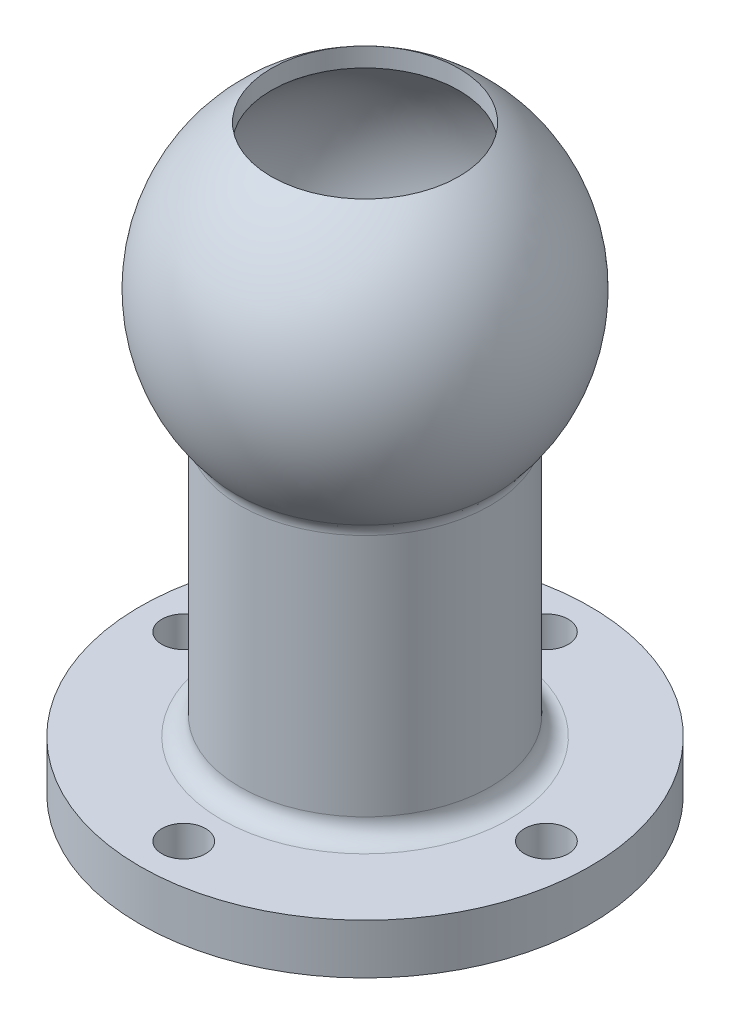
from build123d import *

# Parameters (mm, degrees)
IZIM1_R                     = 36
Y_KSEKLIK_EKSTR_ZYON1_DEPTH = 8
IZIM2_R                     = 3.5
KES_EKSTR_ZYON1_DEPTH       = 8
IZIM3_R                     = 17.5
KES_EKSTR_ZYON2_DEPTH       = 2
IZIM4_W                     = 20
IZIM4_H                     = 29
KES_EKSTR_ZYON3_DEPTH       = 29
KES_EKSTR_ZYON3_DEPTH_BACK  = 6
IZIM5_R                     = 15
Y_KSEKLIK_EKSTR_ZYON2_START = 3
IZIM6_R                     = 20
Y_KSEKLIK_EKSTR_ZYON2_DEPTH = 3
IZIM8_R                     = 12.5
KES_EKSTR_ZYON4_DEPTH       = 3
IZIM13_R                    = 15
KES_EKSTR_ZYON5_DEPTH       = 65
RADYUS2_R                   = 3
RADYUS3_R                   = 3
RADYUS4_R                   = 3


with BuildPart() as part:
    # Çizim1 → Yükseklik-Ekstrüzyon1 (new body)
    with BuildSketch(Plane(origin=(0, 0, 0), x_dir=(1, 0, 0), z_dir=(0, 1, 0))):
        with Locations(Location((0, 0, 0), (0, 0, 270))):
            Circle(IZIM1_R)
    extrude(amount=Y_KSEKLIK_EKSTR_ZYON1_DEPTH)

    # Çizim2 → Kes-Ekstrüzyon1 (cut)
    with BuildSketch(Plane(origin=(0, 8, 0), x_dir=(1, 0, 0), z_dir=(0, 1, 0))):
        with Locations(Location((0, 29, 0), (0, 0, 270))):
            Circle(IZIM2_R)
        with Locations(Location((29, 0, 0), (0, 0, 270))):
            Circle(IZIM2_R)
        with Locations(Location((0, -29, 0), (0, 0, 270))):
            Circle(IZIM2_R)
        with Locations(Location((-29, 0, 0), (0, 0, 270))):
            Circle(IZIM2_R)
    extrude(amount=-KES_EKSTR_ZYON1_DEPTH, mode=Mode.SUBTRACT)

    # Çizim3 → Kes-Ekstrüzyon2 (cut)
    with BuildSketch(Plane.XZ):
        with Locations(Location((0, 0, 0), (0, 0, 270))):
            Circle(IZIM3_R)
    extrude(amount=-KES_EKSTR_ZYON2_DEPTH, mode=Mode.SUBTRACT)

    # Çizim4 → Döndür1 (revolve)
    with BuildSketch(Plane(origin=(0, 0, 0), x_dir=(0, 0, -1), z_dir=(1, 0, 0)), mode=Mode.PRIVATE) as d_nd_r1_sk:
        with Locations((10, 22.5)):
            Rectangle(IZIM4_W, IZIM4_H)
    revolve(d_nd_r1_sk.sketch.rotate(Axis((0, 37, 0), (0, -1, 0)), 180), axis=Axis((0, 37, 0), (0, -1, 0)))

    # Çizim5 → Kes-Ekstrüzyon3 (cut, two sides: drawn at the far end of the back side and taken through both)
    with BuildSketch(Plane(origin=(0, 8, 0), x_dir=(1, 0, 0), z_dir=(0, 1, 0)).offset(-KES_EKSTR_ZYON3_DEPTH_BACK)):
        with Locations(Location((0, 0, 0), (0, 0, 270))):
            Circle(IZIM5_R)
    extrude(amount=KES_EKSTR_ZYON3_DEPTH + KES_EKSTR_ZYON3_DEPTH_BACK, mode=Mode.SUBTRACT)

    # Çizim6 → Yükseklik-Ekstrüzyon2 (add)
    with BuildSketch(Plane(origin=(0, 37, 0), x_dir=(1, 0, 0), z_dir=(0, 1, 0)).offset(Y_KSEKLIK_EKSTR_ZYON2_START)):
        with Locations(Location((0, 0, 0), (0, 0, 270))):
            Circle(IZIM6_R)
    extrude(amount=-Y_KSEKLIK_EKSTR_ZYON2_DEPTH)

    # Çizim8 → Kes-Ekstrüzyon4 (cut)
    with BuildSketch(Plane.XZ.offset(-37)):
        with Locations(Location((0, 0, 0), (0, 0, 270))):
            Circle(IZIM8_R)
    extrude(amount=-KES_EKSTR_ZYON4_DEPTH, mode=Mode.SUBTRACT)



with BuildPart() as body_2:
    # Çizim10 → Döndür15 (revolve)
    with BuildSketch(Plane.XY, mode=Mode.PRIVATE) as d_nd_r15_sk:
        with BuildLine():
            Line((0, 95), (0, 97.5))
            ThreePointArc((0, 97.5), (-25.251743677, 80.89033706), (-20, 51.125413912))
            ThreePointArc((-20, 51.125413912), (-10.89033706, 44.748256323), (0, 42.5))
            Line((0, 42.5), (0, 45))
            ThreePointArc((0, 45), (-25, 70), (0, 95))
        make_face()
    revolve(d_nd_r15_sk.sketch.rotate(Axis((0, 97.5, 0), (0, -1, 0)), 180), axis=Axis((0, 97.5, 0), (0, -1, 0)))


with BuildPart() as part_1:
    add(part.part)

    add(body_2.part)  # Döndür17 merges body 2
    # Çizim10<16> → Döndür17 (revolve)
    with BuildSketch(Plane.XY, mode=Mode.PRIVATE) as d_nd_r17_sk:
        with BuildLine():
            Line((-20, 51.125413912), (-20, 40))
            Line((-20, 40), (0, 40))
            Line((0, 40), (0, 42.5))
            ThreePointArc((0, 42.5), (-10.89033706, 44.748256323), (-20, 51.125413912))
        make_face()
    revolve(d_nd_r17_sk.sketch.rotate(Axis((0, 97.5, 0), (0, -1, 0)), 270), axis=Axis((0, 97.5, 0), (0, -1, 0)))

    # Çizim13 → Kes-Ekstrüzyon5 (cut)
    with BuildSketch(Plane.XZ.offset(-40)):
        with Locations(Location((0, 0, 0), (0, 0, 90))):
            Circle(IZIM13_R)
    extrude(amount=-KES_EKSTR_ZYON5_DEPTH, mode=Mode.SUBTRACT)

    # Radyus2
    radyus2_edges = [part_1.edges().sort_by_distance(p)[0] for p in [
        (14.142135624, 51.125413912, 14.142135624),
    ]]
    fillet(radyus2_edges, radius=RADYUS2_R)

    # Radyus3
    # the kernel refuses this fillet: 3 mm, written as the material it adds along each edge
    with BuildSketch(Plane(origin=(0, 40, 0), x_dir=(0, 0, 1), z_dir=(1, 0, 0))) as radyus3_piece_1:
        with BuildLine():
            CenterArc((12, -2.958039892), RADYUS3_R, 0, 80.405931773)
            Line((12.5, 0), (12.51, 0.059160798))
            ThreePointArc((12.51, 0.059160798), (13.75, 0.06), (15, 0.06))
            Line((15, 0.06), (15.06, 0))
            Line((15.06, 0), (15.06, -2.958039892))
            Line((15.06, -2.958039892), (15, -2.958039892))
        make_face()
    revolve(axis=Axis((0, 40, 0), (0, -1, 0)))

    # Radyus4
    radyus4_edges = [part_1.edges().sort_by_distance(p)[0] for p in [
        (0, 8, -20),
    ]]
    fillet(radyus4_edges, radius=RADYUS4_R)


solid = part_1.part
